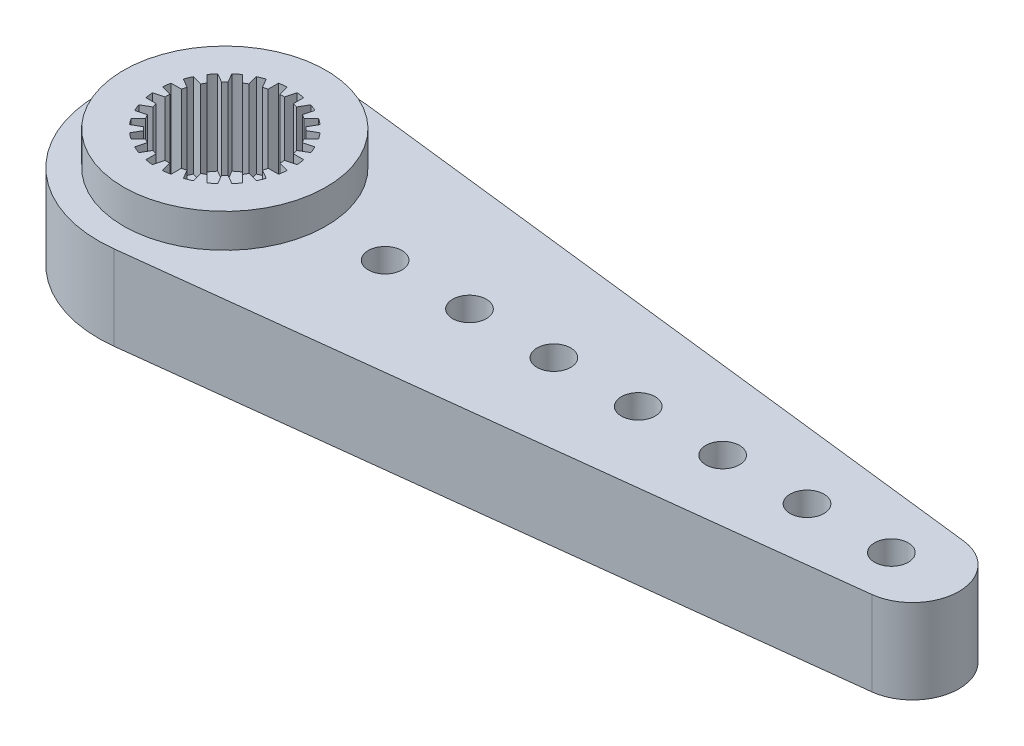
from build123d import *

# Parameters (mm, degrees)
ESQUISSE1_R                  = 1.6
BOSS_EXTRU_1_DEPTH           = 8
ESQUISSE2_R                  = 1
ENL_V_MAT_EXTRU_1_DEPTH      = 8
R_P_TITION_LIN_AIRE1_COUNT   = 7
R_P_TITION_LIN_AIRE1_PITCH   = 5
ESQUISSE3_W                  = 63.02569825
ESQUISSE3_H                  = 22.447508966
ESQUISSE3_R                  = 6
ENL_V_MAT_EXTRU_2_DEPTH      = 2
ESQUISSE4_W                  = 65.150237544
ESQUISSE4_H                  = 23.585889013
ESQUISSE4_R                  = 4.65
ENL_V_MAT_EXTRU_3_DEPTH      = 1
ESQUISSE5_R                  = 2.75
ENL_V_MAT_EXTRU_4_DEPTH      = 1
CHANFREIN1_SIZE              = 1
ESQUISSE6_R                  = 4
ENL_V_MAT_EXTRU_5_DEPTH      = 5
BOSS_EXTRU_2_DEPTH           = 5
R_P_TITION_CIRCULAIRE1_COUNT = 24
ESCALA2_SCALE                = 0.7
ESCALA5_SCALE                = 0.8
ESCALA6_SCALE                = 0.9
ESCALA7_SCALE                = 0.9
ESCALA8_SCALE                = 1.05
ESCALA9_SCALE                = 1.2
ESCALA11_SCALE               = 0.8


with BuildPart() as part:
    # Esquisse1 → Boss.-Extru.1 (new body)
    with BuildSketch(Plane(origin=(0, 0, 0), x_dir=(1, 0, 0), z_dir=(0, 1, 0))):
        with BuildLine():
            Line((0.874233129, -7.448873501), (41.070552147, -2.731253617))
            ThreePointArc((41.070552147, -2.731253617), (43.5, 0), (41.070552147, 2.731253617))
            Line((41.070552147, 2.731253617), (0.874233129, 7.448873501))
            ThreePointArc((0.874233129, 7.448873501), (-7.5, 0), (0.874233129, -7.448873501))
        make_face()
        with Locations(Location((0, 0, 0), (0, 0, 270))):
            Circle(ESQUISSE1_R, mode=Mode.SUBTRACT)
    extrude(amount=BOSS_EXTRU_1_DEPTH)

    # Esquisse2 → Enlèv. mat.-Extru.1 (cut)
    with BuildSketch(Plane(origin=(0, 8, 0), x_dir=(1, 0, 0), z_dir=(0, 1, 0))):
        with Locations(Location((9.5, 0, 0), (0, 0, 270))):
            Circle(ESQUISSE2_R)
    enl_v_mat_extru_1 = extrude(amount=-ENL_V_MAT_EXTRU_1_DEPTH, mode=Mode.SUBTRACT)

    # Répétition linéaire1: Enlèv. mat.-Extru.1 ×7
    with Locations(*[(i * R_P_TITION_LIN_AIRE1_PITCH, 0, 0) for i in range(1, R_P_TITION_LIN_AIRE1_COUNT)]):
        add(enl_v_mat_extru_1, mode=Mode.SUBTRACT)

    # Esquisse3 → Enlèv. mat.-Extru.2 (cut)
    with BuildSketch(Plane(origin=(0, 8, 0), x_dir=(1, 0, 0), z_dir=(0, 1, 0))):
        with Locations((18.729808022, -1.006570064)):
            Rectangle(ESQUISSE3_W, ESQUISSE3_H)
        with Locations(Location((0, 0, 0), (0, 0, 270))):
            Circle(ESQUISSE3_R, mode=Mode.SUBTRACT)
    extrude(amount=-ENL_V_MAT_EXTRU_2_DEPTH, mode=Mode.SUBTRACT)

    # Esquisse4 → Enlèv. mat.-Extru.3 (cut)
    with BuildSketch(Plane.XZ):
        with Locations((19.098187779, 0.565848797)):
            Rectangle(ESQUISSE4_W, ESQUISSE4_H)
        with Locations(Location((0, 0, 0), (0, 0, 270))):
            Circle(ESQUISSE4_R, mode=Mode.SUBTRACT)
    extrude(amount=-ENL_V_MAT_EXTRU_3_DEPTH, mode=Mode.SUBTRACT)

    # Esquisse5 → Enlèv. mat.-Extru.4 (cut)
    with BuildSketch(Plane.XZ):
        with Locations(Location((0, 0, 0), (0, 0, 270))):
            Circle(ESQUISSE5_R)
    extrude(amount=-ENL_V_MAT_EXTRU_4_DEPTH, mode=Mode.SUBTRACT)

    # Chanfrein1
    chanfrein1_edges = [part.edges().sort_by_distance(p)[0] for p in [
        (0, 1, 4.65),
    ]]
    chamfer(chanfrein1_edges, length=CHANFREIN1_SIZE - 0.0001)  # a hair under: the kernel refuses the full size

    # Esquisse6 → Enlèv. mat.-Extru.5 (cut)
    with BuildSketch(Plane(origin=(0, 8, 0), x_dir=(1, 0, 0), z_dir=(0, 1, 0))):
        with Locations(Location((0, 0, 0), (0, 0, 270))):
            Circle(ESQUISSE6_R)
    extrude(amount=-ENL_V_MAT_EXTRU_5_DEPTH, mode=Mode.SUBTRACT)

    # Esquisse7 → Boss.-Extru.2 (add)
    with BuildSketch(Plane(origin=(0, 8, 0), x_dir=(1, 0, 0), z_dir=(0, 1, 0))):
        Polygon((0.3, -4), (0.139230485, -3.4), (-0.139230485, -3.4), (-0.3, -4), align=None)
    boss_extru_2 = extrude(amount=-BOSS_EXTRU_2_DEPTH)

    # Répétition circulaire1: Boss.-Extru.2 ×24 about axis
    r_p_tition_circulaire1_axis = Axis((0, 0, 0), (0, 1, 0))
    for i in range(1, R_P_TITION_CIRCULAIRE1_COUNT):
        add(boss_extru_2.rotate(r_p_tition_circulaire1_axis, i * 360 / R_P_TITION_CIRCULAIRE1_COUNT))


with BuildPart() as part_1:
    # Escala2: scaled about (13.607866543, 3.578266839, 0)
    add(part.part.scale(ESCALA2_SCALE).moved(Location((4.082359963, 1.073480052, 0))))


with BuildPart() as part_2:
    # Escala5: scaled about (13.607866543, 3.578266839, 0)
    add(part_1.part.scale(ESCALA5_SCALE).moved(Location((2.721573309, 0.715653368, 0))))


with BuildPart() as part_3:
    # Escala6: scaled about (13.607866543, 3.578266839, 0)
    add(part_2.part.scale(ESCALA6_SCALE).moved(Location((1.360786654, 0.357826684, 0))))


with BuildPart() as part_4:
    # Escala7: scaled about (13.607866543, 3.578266839, 0)
    add(part_3.part.scale(ESCALA7_SCALE).moved(Location((1.360786654, 0.357826684, 0))))


with BuildPart() as part_5:
    # Escala8: scaled about (13.607866543, 3.578266839, 0)
    add(part_4.part.scale(ESCALA8_SCALE).moved(Location((-0.680393327, -0.178913342, 0))))


with BuildPart() as part_6:
    # Escala9: scaled about (13.607866543, 3.578266839, 0)
    add(part_5.part.scale(ESCALA9_SCALE).moved(Location((-2.721573309, -0.715653368, 0))))


with BuildPart() as part_7:
    # Escala11: scaled about (13.607866543, 3.578266839, 0)
    add(part_6.part.scale(ESCALA11_SCALE).moved(Location((2.721573309, 0.715653368, 0))))


solid = part_7.part
